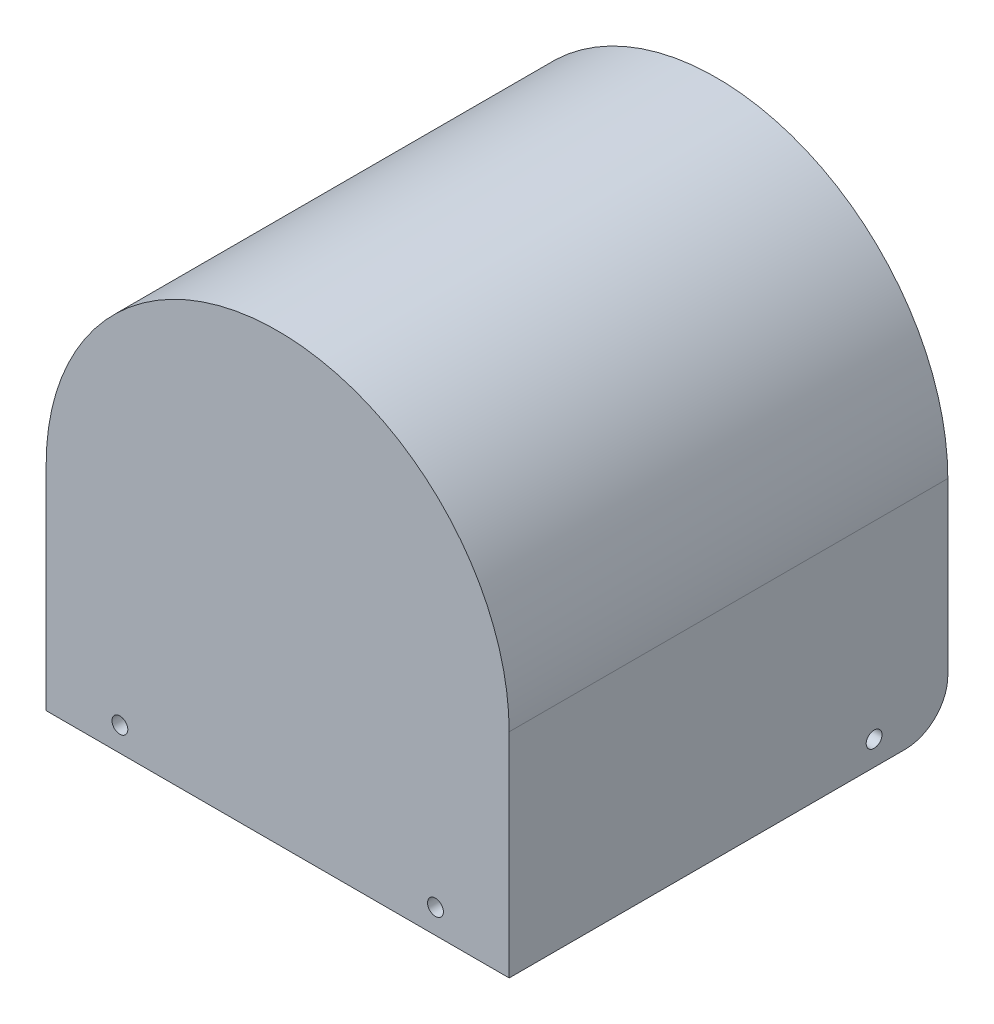
from build123d import *

# Parameters (mm, degrees)
BOSS_EXTRUDE1_DEPTH                  = 72
SKETCH2_W                            = 72
SKETCH2_H                            = 2
BOSS_EXTRUDE2_DEPTH                  = 35
BOSS_EXTRUDE2_DIRECTION_2_REACH      = 91.844
BOSS_EXTRUDE2_DIRECTION_2_END_RADIUS = 36
SKETCH3_R                            = 1.3
CUT_EXTRUDE1_DEPTH                   = 10
SKETCH4_R                            = 1.3
CUT_EXTRUDE2_DEPTH                   = 112.373246339
FILLET1_R                            = 7


with BuildPart() as part:
    # Sketch1 → Boss-Extrude1 (new body)
    with BuildSketch(Plane.XY):
        with BuildLine():
            Line((-36, 0), (-36, -35))
            Line((-36, -35), (-38, -35))
            Line((-38, -35), (-38, 0))
            ThreePointArc((-38, 0), (0, 38), (38, 0))
            Line((38, 0), (38, -35))
            Line((38, -35), (36, -35))
            Line((36, -35), (36, 0))
            ThreePointArc((36, 0), (0, 36), (-36, 0))
        make_face()
    extrude(amount=BOSS_EXTRUDE1_DEPTH)

    # Sketch2 → Boss-Extrude2 (add)
    with BuildSketch(Plane(origin=(0, 0, 0), x_dir=(1, 0, 0), z_dir=(0, 1, 0))):
        with Locations((0, -71)):
            Rectangle(SKETCH2_W, SKETCH2_H)
    extrude(amount=-BOSS_EXTRUDE2_DEPTH)

    # Boss-Extrude2 direction 2: up to this cylinder (the profile starts inside it)
    boss_extrude2_direction_2_end = Plane(origin=(0, 0, 71), z_dir=(0, 0, -1)) * Cylinder(BOSS_EXTRUDE2_DIRECTION_2_END_RADIUS, 256.688, mode=Mode.PRIVATE)
    # Sketch2 → Boss-Extrude2 direction 2 (add, up to the surface)
    with BuildSketch(Plane(origin=(0, 0, 0), x_dir=(1, 0, 0), z_dir=(0, 1, 0)), mode=Mode.PRIVATE) as boss_extrude2_direction_2_sk1:
        with Locations((0, -71)):
            Rectangle(SKETCH2_W, SKETCH2_H)
    boss_extrude2_direction_2_tool1 = extrude(boss_extrude2_direction_2_sk1.sketch, amount=BOSS_EXTRUDE2_DIRECTION_2_REACH, mode=Mode.PRIVATE) & boss_extrude2_direction_2_end
    add(boss_extrude2_direction_2_tool1.solids().sort_by_distance((0, 0, 71))[0])

    # Sketch3 → Cut-Extrude1 (cut)
    with BuildSketch(Plane.XY.offset(72)):
        with Locations((-25.9, -31)):
            Circle(SKETCH3_R)
        with Locations((25.9, -31)):
            Circle(SKETCH3_R)
    extrude(amount=-CUT_EXTRUDE1_DEPTH, mode=Mode.SUBTRACT)

    # Sketch4 → Cut-Extrude2 (cut, through all)
    with BuildSketch(Plane(origin=(38, 0, 0), x_dir=(0, 0, -1), z_dir=(1, 0, 0))):
        with Locations((-12.1, -31)):
            Circle(SKETCH4_R)
    extrude(amount=-CUT_EXTRUDE2_DEPTH, mode=Mode.SUBTRACT)

    # Fillet1
    fillet1_edges = [part.edges().sort_by_distance(p)[0] for p in [
        (-37, -35, 0),
        (37, -35, 0),
    ]]
    fillet(fillet1_edges, radius=FILLET1_R)


solid = part.part
